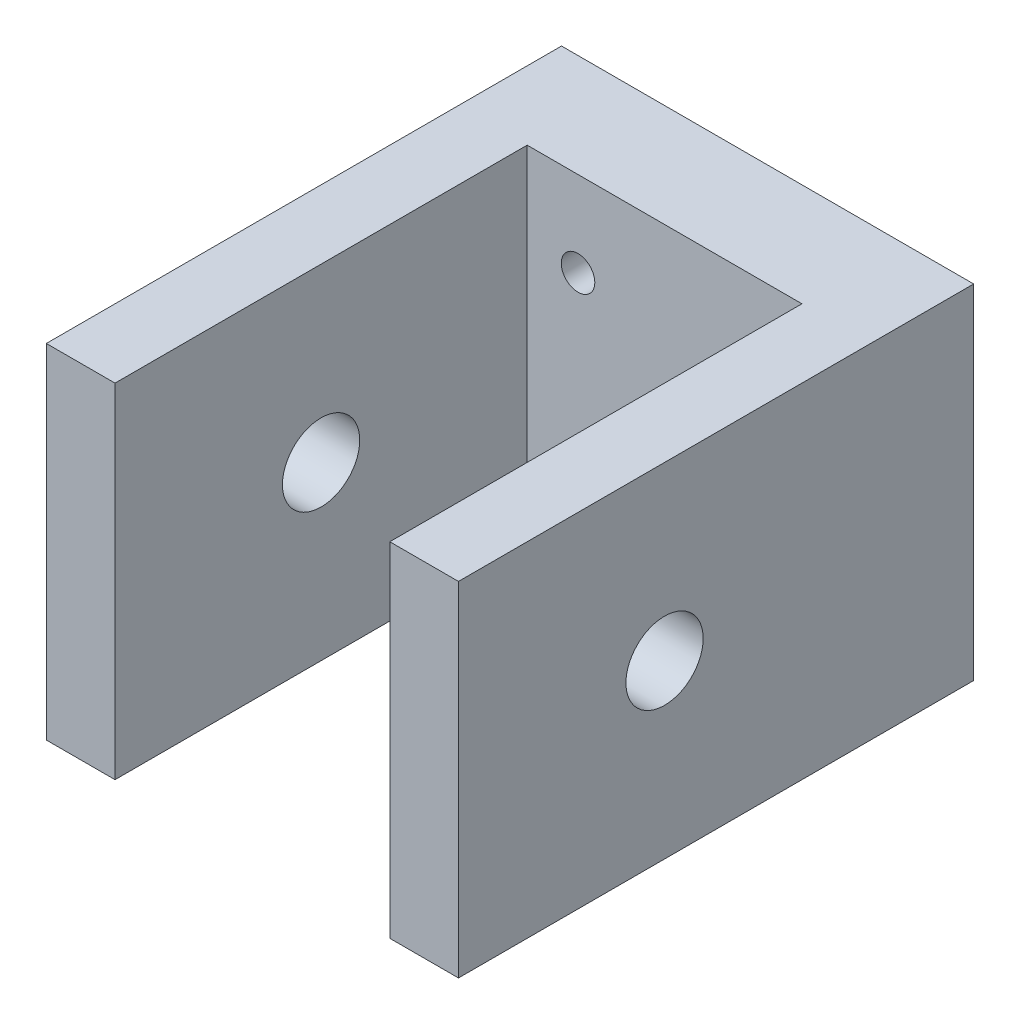
from build123d import *

# Parameters (mm, degrees)
BOSS_EXTRUDE1_DEPTH     = 15.875
M2_5_CLEARANCE_HOLE1_D  = 3.1
F_1_4_CLEARANCE_HOLE1_D = 7.14248
SKETCH7_W               = 6.1468
SKETCH7_H               = 5.4483
CUT_EXTRUDE1_DEPTH      = 1.1771


with BuildPart() as part:
    # Sketch2 → Boss-Extrude1 (new, symmetric)
    with BuildSketch(Plane(origin=(0, 0, 0), x_dir=(1, 0, 0), z_dir=(0, 1, 0))):
        Polygon((-12.7, 0), (-12.7, -38.1), (-19.05, -38.1), (-19.05, 9.525), (19.05, 9.525), (19.05, -38.1), (12.7, -38.1), (12.7, 0), align=None)
    extrude(amount=BOSS_EXTRUDE1_DEPTH, both=True)

    # M2.5 Clearance Hole1 (through all)
    with Locations(Plane(origin=(0, 0, -9.525), x_dir=(-1, 0, 0), z_dir=(0, 0, -1))):
        with Locations((8, 8), (-8, 8), (-8, -8), (8, -8)):
            Hole(M2_5_CLEARANCE_HOLE1_D / 2)

    # 1/4 Clearance Hole1 (through all)
    with Locations(Plane(origin=(19.05, 0, 0), x_dir=(0, 0, -1), z_dir=(1, 0, 0))):
        with Locations((-19.05, 0)):
            Hole(F_1_4_CLEARANCE_HOLE1_D / 2)

    # Sketch7 → Cut-Extrude1 (cut, symmetric)
    with BuildSketch(Plane.XY.offset(-4.7625)):
        with Locations((8, 8)):
            Rectangle(SKETCH7_W, SKETCH7_H)
        with Locations((-8, 8)):
            Rectangle(SKETCH7_W, SKETCH7_H)
        with Locations((-8, -8)):
            Rectangle(SKETCH7_W, SKETCH7_H)
        with Locations((8, -8)):
            Rectangle(SKETCH7_W, SKETCH7_H)
    extrude(amount=CUT_EXTRUDE1_DEPTH, both=True, mode=Mode.SUBTRACT)


solid = part.part
